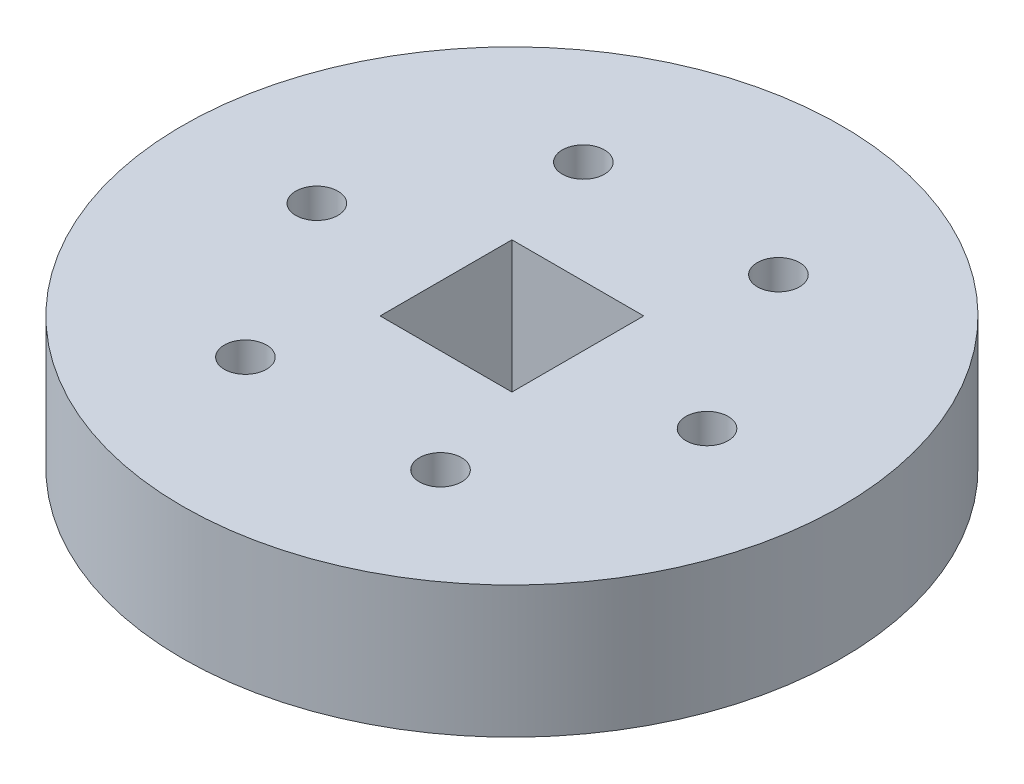
from build123d import *

# Parameters (mm, degrees)
ELEVATOR_SUPPORT_PULLEYS_R   = 15.875
ELEVATOR_SUPPORT_PULLEYS_R_2 = 1.016
ELEVATOR_SUPPORT_PULLEYS_W   = 6.35
ELEVATOR_SUPPORT_PULLEYS_H   = 6.35
BOSS_EXTRUDE1_DEPTH          = 6.35


with BuildPart() as part:
    # Elevator Support Pulleys → Boss-Extrude1 (new body)
    with BuildSketch(Plane(origin=(0, 0, 0), x_dir=(1, 0, 0), z_dir=(0, 1, 0))):
        Circle(ELEVATOR_SUPPORT_PULLEYS_R)
        with Locations((9.398, 0)):
            Circle(ELEVATOR_SUPPORT_PULLEYS_R_2, mode=Mode.SUBTRACT)
        with Locations((4.699, -8.138906745)):
            Circle(ELEVATOR_SUPPORT_PULLEYS_R_2, mode=Mode.SUBTRACT)
        with Locations((-4.699, -8.138906745)):
            Circle(ELEVATOR_SUPPORT_PULLEYS_R_2, mode=Mode.SUBTRACT)
        with Locations((-9.398, 0)):
            Circle(ELEVATOR_SUPPORT_PULLEYS_R_2, mode=Mode.SUBTRACT)
        with Locations((-4.699, 8.138906745)):
            Circle(ELEVATOR_SUPPORT_PULLEYS_R_2, mode=Mode.SUBTRACT)
        with Locations((4.699, 8.138906745)):
            Circle(ELEVATOR_SUPPORT_PULLEYS_R_2, mode=Mode.SUBTRACT)
        Rectangle(ELEVATOR_SUPPORT_PULLEYS_W, ELEVATOR_SUPPORT_PULLEYS_H, mode=Mode.SUBTRACT)
    extrude(amount=BOSS_EXTRUDE1_DEPTH)


solid = part.part
